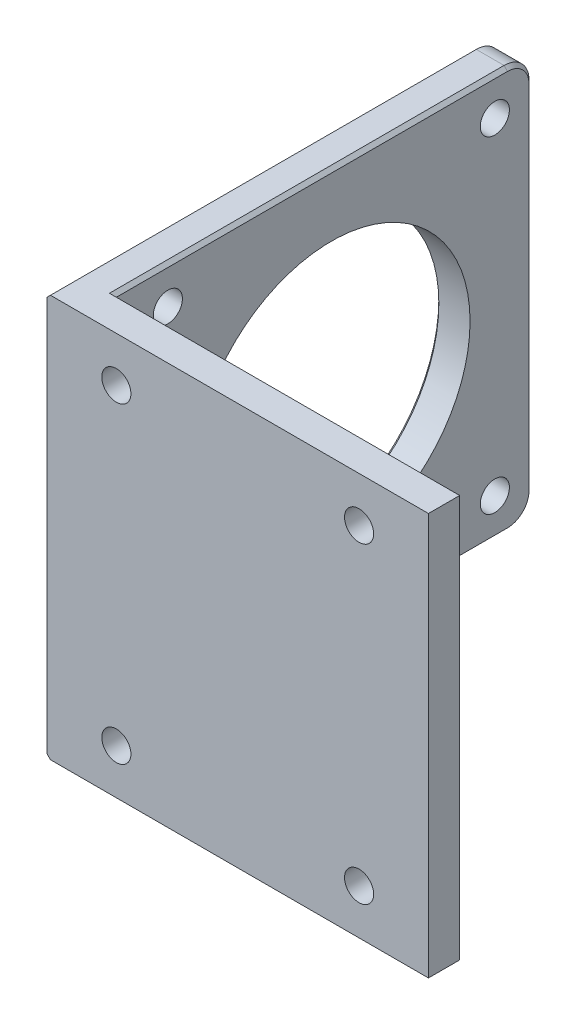
from build123d import *

# Parameters (mm, degrees)
BOSS_EXTRUDE2_DEPTH   = 58
SKETCH3_R             = 20
CUT_EXTRUDE3_DEPTH    = 101.444014257
M5X0_8_TAPPED_HOLE3_D = 4.2
M5X0_8_TAPPED_HOLE2_D = 4.2
FILLET1_R             = 3.6
CHAMFER1_SIZE         = 0.5


with BuildPart() as part:
    # Sketch2 → Boss-Extrude2 (new body)
    with BuildSketch(Plane(origin=(0, 0, 0), x_dir=(1, 0, 0), z_dir=(0, 1, 0))):
        Polygon((0, 0), (0, 65), (5, 65), (5, 5), (55, 5), (55, 0), align=None)
    extrude(amount=BOSS_EXTRUDE2_DEPTH)

    # Sketch3 → Cut-Extrude3 (cut, through all)
    with BuildSketch(Plane.ZY.offset(-5)):
        with Locations((-36, 29)):
            Circle(SKETCH3_R)
    extrude(amount=CUT_EXTRUDE3_DEPTH, mode=Mode.SUBTRACT)

    # M5x0.8 Tapped Hole3 (through all)
    with Locations(Plane.XY):
        with Locations((10, 6.5), (10, 51.5), (45, 51.5), (45, 6.5)):
            Hole(M5X0_8_TAPPED_HOLE3_D / 2)

    # M5x0.8 Tapped Hole2 (through all)
    with Locations(Plane.ZY):
        with Locations((-12.426827682, 5.426827682), (-12.426827682, 52.573172318), (-59.573172318, 52.573172318), (-59.573172318, 5.426827682)):
            Hole(M5X0_8_TAPPED_HOLE2_D / 2)

    # Fillet1
    fillet1_edges = [part.edges().sort_by_distance(p)[0] for p in [
        (2.5, 58, -65),
        (2.5, 0, -65),
    ]]
    fillet(fillet1_edges, radius=FILLET1_R)

    # Chamfer1
    chamfer1_edges = [part.edges().sort_by_distance(p)[0] for p in [
        (0, 58, -30.7),
        (0, 56.945584412, -63.945584412),
        (0, 29, -65),
        (0, 1.054415588, -63.945584412),
        (0, 0, -30.7),
        (5, 58, -33.2),
        (5, 56.945584412, -63.945584412),
        (5, 1.054415588, -63.945584412),
        (30, 58, -5),
        (55, 29, -5),
        (30, 0, -5),
        (5, 0, -33.2),
        (0, 29, -56),
        (5, 29, -65),
    ]]
    chamfer(chamfer1_edges, length=CHAMFER1_SIZE)


solid = part.part
